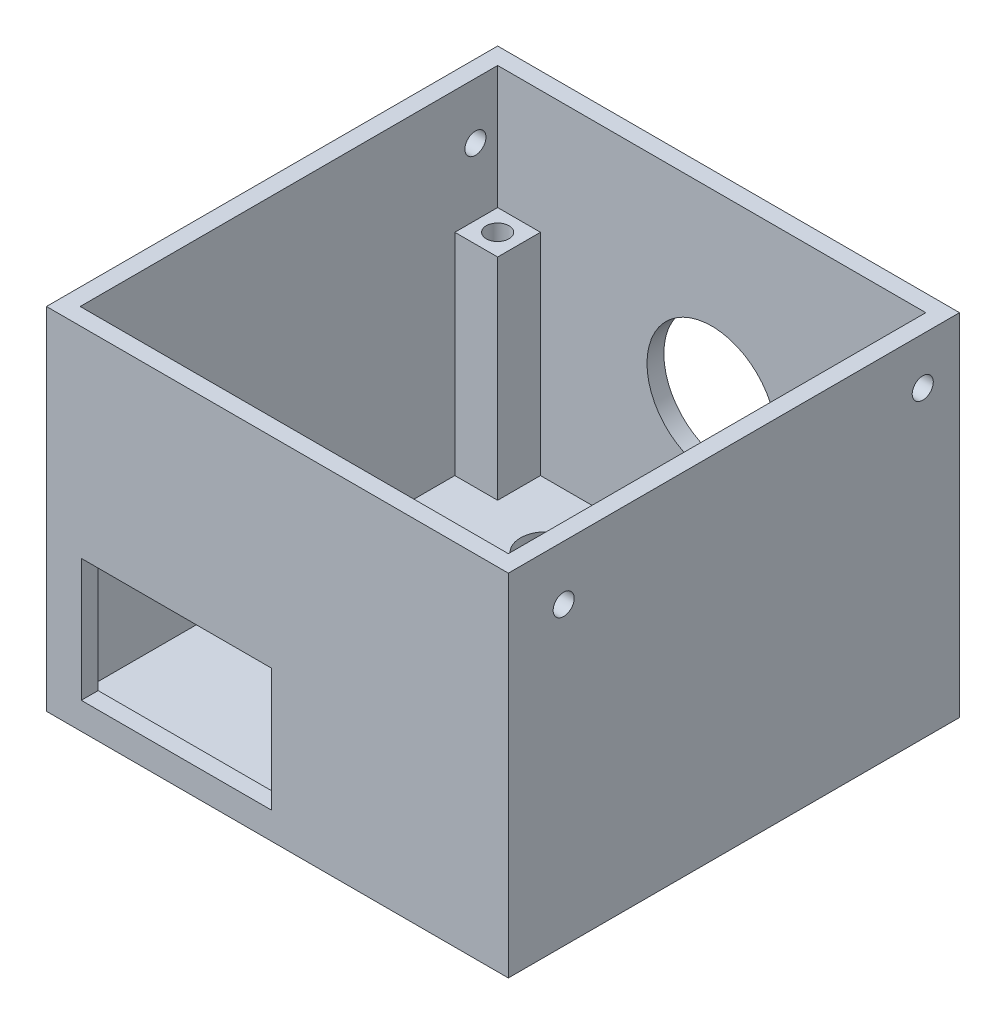
from build123d import *

# Parameters (mm, degrees)
SKETCH1_W           = 54.8
SKETCH1_H           = 53.53
BOSS_EXTRUDE1_DEPTH = 41.6
SKETCH2_W           = 50.8
SKETCH2_H           = 49.53
CUT_EXTRUDE1_DEPTH  = 39.6
SKETCH3_W           = 5.08
SKETCH3_H           = 5.08
BOSS_EXTRUDE2_DEPTH = 25
SKETCH4_R           = 1.35
CUT_EXTRUDE2_DEPTH  = 10
CUT_EXTRUDE3_REACH  = 58.548
SKETCH5_R           = 3
CUT_EXTRUDE4_REACH  = 58.548
SKETCH6_R           = 3.1
CUT_EXTRUDE5_REACH  = 58.548
SKETCH7_R           = 3.6
CUT_EXTRUDE6_REACH  = 75.824
SKETCH8_R           = 1.25
CUT_EXTRUDE7_REACH  = 75.824
SKETCH10_R          = 1.25
CUT_EXTRUDE8_REACH  = 75.122
SKETCH12_R          = 7.680495542
CUT_EXTRUDE9_REACH  = 75.122
SKETCH13_W          = 22.581735489
SKETCH13_H          = 14.589690318
CUT_EXTRUDE10_REACH = 75.824
SKETCH14_R          = 1.25


with BuildPart() as part:
    # Sketch1 → Boss-Extrude1 (new body)
    with BuildSketch(Plane(origin=(0, 0, 0), x_dir=(1, 0, 0), z_dir=(0, 1, 0))):
        Rectangle(SKETCH1_W, SKETCH1_H)
    extrude(amount=BOSS_EXTRUDE1_DEPTH)

    # Sketch2 → Cut-Extrude1 (cut)
    with BuildSketch(Plane(origin=(0, 41.6, 0), x_dir=(1, 0, 0), z_dir=(0, 1, 0))):
        Rectangle(SKETCH2_W, SKETCH2_H)
    extrude(amount=-CUT_EXTRUDE1_DEPTH, mode=Mode.SUBTRACT)

    # Sketch3 → Boss-Extrude2 (add)
    with BuildSketch(Plane(origin=(0, 2, 0), x_dir=(1, 0, 0), z_dir=(0, 1, 0))):
        with Locations((-22.86, 22.225)):
            Rectangle(SKETCH3_W, SKETCH3_H)
        with Locations((22.86, 22.225)):
            Rectangle(SKETCH3_W, SKETCH3_H)
        with Locations((22.86, -22.225)):
            Rectangle(SKETCH3_W, SKETCH3_H)
    extrude(amount=BOSS_EXTRUDE2_DEPTH)

    # Sketch4 → Cut-Extrude2 (cut)
    with BuildSketch(Plane(origin=(0, 27, 0), x_dir=(1, 0, 0), z_dir=(0, 1, 0))):
        with Locations((-22.86, 22.225)):
            Circle(SKETCH4_R)
        with Locations((22.86, 22.225)):
            Circle(SKETCH4_R)
        with Locations((22.86, -22.225)):
            Circle(SKETCH4_R)
    extrude(amount=-CUT_EXTRUDE2_DEPTH, mode=Mode.SUBTRACT)

    # Sketch5 → Cut-Extrude3 (cut, up to next)
    with BuildSketch(Plane(origin=(0, 0, 0), x_dir=(-1, 0, 0), z_dir=(0, -1, 0)), mode=Mode.PRIVATE) as cut_extrude3_sk1:
        with Locations((-12.762863618, 17.186859774)):
            Circle(SKETCH5_R)
    cut_extrude3_tool1 = extrude(cut_extrude3_sk1.sketch, amount=-CUT_EXTRUDE3_REACH, mode=Mode.PRIVATE) & part.part
    # Sketch5 → Cut-Extrude3 (cut, up to next)
    with BuildSketch(Plane(origin=(0, 0, 0), x_dir=(-1, 0, 0), z_dir=(0, -1, 0)), mode=Mode.PRIVATE) as cut_extrude3_sk2:
        with Locations((12.108357792, 17.186859774)):
            Circle(SKETCH5_R)
    cut_extrude3_tool2 = extrude(cut_extrude3_sk2.sketch, amount=-CUT_EXTRUDE3_REACH, mode=Mode.PRIVATE) & part.part
    add(cut_extrude3_tool1.solids().sort_by_distance((12.762864, 0, -17.18686))[0], mode=Mode.SUBTRACT)
    add(cut_extrude3_tool2.solids().sort_by_distance((-12.108358, 0, -17.18686))[0], mode=Mode.SUBTRACT)

    # Sketch6 → Cut-Extrude4 (cut, up to next)
    with BuildSketch(Plane(origin=(0, 0, 0), x_dir=(-1, 0, 0), z_dir=(0, -1, 0)), mode=Mode.PRIVATE) as cut_extrude4_sk1:
        with Locations((-16.908067186, 1.527180262)):
            Circle(SKETCH6_R)
    cut_extrude4_tool1 = extrude(cut_extrude4_sk1.sketch, amount=-CUT_EXTRUDE4_REACH, mode=Mode.PRIVATE) & part.part
    # Sketch6 → Cut-Extrude4 (cut, up to next)
    with BuildSketch(Plane(origin=(0, 0, 0), x_dir=(-1, 0, 0), z_dir=(0, -1, 0)), mode=Mode.PRIVATE) as cut_extrude4_sk2:
        with Locations((-8.726744354, 1.527180262)):
            Circle(SKETCH6_R)
    cut_extrude4_tool2 = extrude(cut_extrude4_sk2.sketch, amount=-CUT_EXTRUDE4_REACH, mode=Mode.PRIVATE) & part.part
    add(cut_extrude4_tool1.solids().sort_by_distance((16.908067, 0, -1.52718))[0], mode=Mode.SUBTRACT)
    add(cut_extrude4_tool2.solids().sort_by_distance((8.726744, 0, -1.52718))[0], mode=Mode.SUBTRACT)

    # Sketch7 → Cut-Extrude5 (cut, up to next)
    with BuildSketch(Plane(origin=(0, 0, 0), x_dir=(-1, 0, 0), z_dir=(0, -1, 0)), mode=Mode.PRIVATE) as cut_extrude5_sk1:
        with Locations((-12.653779314, -10.035756007)):
            Circle(SKETCH7_R)
    cut_extrude5_tool1 = extrude(cut_extrude5_sk1.sketch, amount=-CUT_EXTRUDE5_REACH, mode=Mode.PRIVATE) & part.part
    add(cut_extrude5_tool1.solids().sort_by_distance((12.653779, 0, 10.035756))[0], mode=Mode.SUBTRACT)

    # Sketch8 → Cut-Extrude6 (cut, up to next)
    with BuildSketch(Plane(origin=(27.4, 0, 0), x_dir=(0, 0, -1), z_dir=(1, 0, 0)), mode=Mode.PRIVATE) as cut_extrude6_sk1:
        with Locations((-20.200858991, 35.113292919)):
            Circle(SKETCH8_R)
    cut_extrude6_tool1 = extrude(cut_extrude6_sk1.sketch, amount=-CUT_EXTRUDE6_REACH, mode=Mode.PRIVATE) & part.part
    add(cut_extrude6_tool1.solids().sort_by_distance((27.4, 35.113293, 20.200859))[0], mode=Mode.SUBTRACT)

    # Sketch10 → Cut-Extrude7 (cut, up to next)
    with BuildSketch(Plane.ZY.offset(27.4), mode=Mode.PRIVATE) as cut_extrude7_sk1:
        with Locations((-22.126795963, 34.935427745)):
            Circle(SKETCH10_R)
    cut_extrude7_tool1 = extrude(cut_extrude7_sk1.sketch, amount=-CUT_EXTRUDE7_REACH, mode=Mode.PRIVATE) & part.part
    add(cut_extrude7_tool1.solids().sort_by_distance((-27.4, 34.935428, -22.126796))[0], mode=Mode.SUBTRACT)

    # Sketch12 → Cut-Extrude8 (cut, up to next)
    with BuildSketch(Plane(origin=(0, 0, -26.765), x_dir=(-1, 0, 0), z_dir=(0, 0, -1)), mode=Mode.PRIVATE) as cut_extrude8_sk1:
        with Locations((0, 19.850785186)):
            Circle(SKETCH12_R)
    cut_extrude8_tool1 = extrude(cut_extrude8_sk1.sketch, amount=-CUT_EXTRUDE8_REACH, mode=Mode.PRIVATE) & part.part
    add(cut_extrude8_tool1.solids().sort_by_distance((0, 19.850785, -26.765))[0], mode=Mode.SUBTRACT)

    # Sketch13 → Cut-Extrude9 (cut, up to next)
    with BuildSketch(Plane.XY.offset(26.765), mode=Mode.PRIVATE) as cut_extrude9_sk1:
        with Locations((-11.980612505, 10.491224969)):
            Rectangle(SKETCH13_W, SKETCH13_H)
    cut_extrude9_tool1 = extrude(cut_extrude9_sk1.sketch, amount=-CUT_EXTRUDE9_REACH, mode=Mode.PRIVATE) & part.part
    add(cut_extrude9_tool1.solids().sort_by_distance((-11.980613, 10.491225, 26.765))[0], mode=Mode.SUBTRACT)

    # Sketch14 → Cut-Extrude10 (cut, up to next)
    with BuildSketch(Plane(origin=(27.4, 0, 0), x_dir=(0, 0, -1), z_dir=(1, 0, 0)), mode=Mode.PRIVATE) as cut_extrude10_sk1:
        with Locations((22.403153775, 36.040667921)):
            Circle(SKETCH14_R)
    cut_extrude10_tool1 = extrude(cut_extrude10_sk1.sketch, amount=-CUT_EXTRUDE10_REACH, mode=Mode.PRIVATE) & part.part
    add(cut_extrude10_tool1.solids().sort_by_distance((27.4, 36.040668, -22.403154))[0], mode=Mode.SUBTRACT)


solid = part.part
